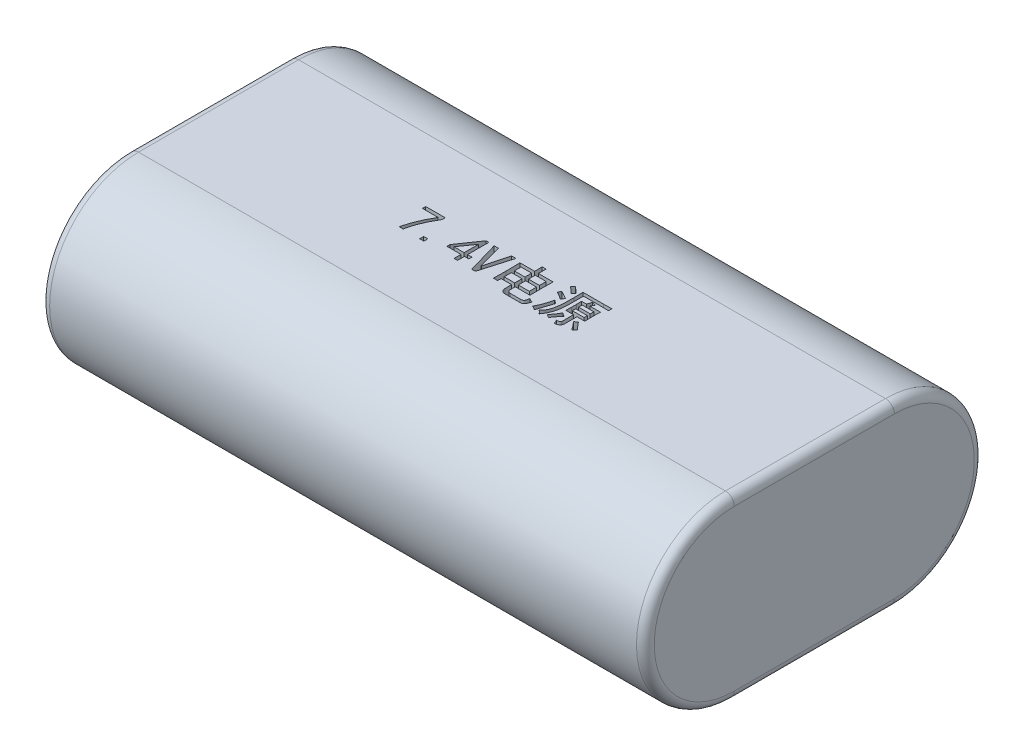
from build123d import *

# Parameters (mm, degrees)
EXTRUDE_1_DEPTH     = 68
FILLET_1_R          = 1
SKETCH_2_W          = 0.470760233
SKETCH_2_H          = 0.450292398
SKETCH_2_W_2        = 1.228070175
SKETCH_2_H_2        = 0.818713451
SKETCH_2_W_3        = 1.187134503
SKETCH_2_H_3        = 0.757309941
SKETCH_2_W_4        = 1.30994152
SKETCH_2_H_4        = 0.409356725
SKETCH_2_H_5        = 0.368421053
CUT_EXTRUDE_1_DEPTH = 2


with BuildPart() as part:
    # 草图1 → 凸台-拉伸1 (new body)
    with BuildSketch(Plane(origin=(0, 0, 0), x_dir=(0, 0, -1), z_dir=(1, 0, 0))):
        with BuildLine():
            Line((-13.318446602, 16.937864078), (4.681553398, 16.937864078))
            ThreePointArc((4.681553398, 16.937864078), (14.681553398, 6.937864078), (4.681553398, -3.062135922))
            Line((4.681553398, -3.062135922), (-13.318446602, -3.062135922))
            ThreePointArc((-13.318446602, -3.062135922), (-23.318446602, 6.937864078), (-13.318446602, 16.937864078))
        make_face()
    extrude(amount=EXTRUDE_1_DEPTH)

    # 圆角1
    fillet_1_edges = [part.edges().sort_by_distance(p)[0] for p in [
        (0, -3.062135922, 4.318446602),
        (0, 6.937864078, -14.681553398),
        (0, 16.937864078, 4.318446602),
        (0, 6.937864078, 23.318446602),
        (68, 16.937864078, 4.318446602),
        (68, 6.937864078, -14.681553398),
        (68, -3.062135922, 4.318446602),
        (68, 6.937864078, 23.318446602),
    ]]
    fillet(fillet_1_edges, radius=FILLET_1_R)

    # 草图2 → 切除-拉伸1 (cut)
    # profile 1 of 12: a face of its own
    with BuildSketch(Plane(origin=(0, 16.937864078, 0), x_dir=(1, 0, 0), z_dir=(0, 1, 0))):
        with BuildLine():
            add(Edge.make_bspline(
                [(22.913839218, -5.925550869), (22.946256994, -5.795595156), (23.011356885, -5.534624048), (23.131271824, -5.146912821), (23.265755822, -4.759243221), (23.418491729, -4.372399105), (23.588692665, -3.98613303), (23.775888162, -3.600437972), (23.980689836, -3.215435809), (24.128651632, -2.962525637), (24.203312902, -2.834907595)],
                knots=[0, 0, 0, 0, 0.95598223, 1.919759698, 2.895862736, 3.884710376, 4.887861096, 5.908430334, 6.944597505, 8, 8, 8, 8], degree=3))
            Line((24.203312902, -2.834907595), (22.443078984, -2.834907595))
            Line((22.443078984, -2.834907595), (22.443078984, -2.466486542))
            Line((22.443078984, -2.466486542), (24.633137464, -2.466486542))
            Line((24.633137464, -2.466486542), (24.633137464, -2.814439758))
            add(Edge.make_bspline(
                [(24.633137464, -2.814439758), (24.555151809, -2.943397307), (24.400982162, -3.198333165), (24.192504454, -3.588376978), (24.002202403, -3.977150388), (23.833055651, -4.36645168), (23.68374422, -4.755474601), (23.556872501, -5.145135171), (23.447536392, -5.53404855), (23.391818079, -5.795590511), (23.364131616, -5.925550869)],
                knots=[0, 0, 0, 0, 1.07060053, 2.116467542, 3.141042998, 4.145328357, 5.131291331, 6.100450916, 7.056112916, 8, 8, 8, 8], degree=3))
            Line((23.364131616, -5.925550869), (22.913839218, -5.925550869))
        make_face()
    # profile 2 of 12: a face of its own
    with BuildSketch(Plane(origin=(0, 16.937864078, 0), x_dir=(1, 0, 0), z_dir=(0, 1, 0))):
        with Locations((25.482552669, -5.720872507)):
            Rectangle(SKETCH_2_W, SKETCH_2_H)
    # profile 3 of 12: a face of its own
    with BuildSketch(Plane(origin=(0, 16.937864078, 0), x_dir=(1, 0, 0), z_dir=(0, 1, 0))):
        Polygon((29.095125768, -5.147773092), (27.519102376, -5.147773092), (27.519102376, -4.799819875), (29.176997113, -2.405083033), (29.484014657, -2.405083033), (29.484014657, -4.799819875), (29.975242727, -4.799819875), (29.975242727, -5.147773092), (29.484014657, -5.147773092), (29.484014657, -5.925550869), (29.095125768, -5.925550869), align=None)
        Polygon((29.095125768, -4.799819875), (29.095125768, -3.182860811), (27.948926938, -4.799819875), align=None, mode=Mode.SUBTRACT)
    # profile 4 of 12: a face of its own
    with BuildSketch(Plane(origin=(0, 16.937864078, 0), x_dir=(1, 0, 0), z_dir=(0, 1, 0))):
        Polygon((32.574657932, -2.446018706), (31.551266119, -5.986954378), (31.141909394, -5.986954378), (30.118517581, -2.446018706), (30.609745651, -2.446018706), (31.32611992, -5.127305255), (31.367055592, -5.127305255), (32.083429861, -2.446018706), align=None)
    # profile 5 of 12: a face of its own
    with BuildSketch(Plane(origin=(0, 16.937864078, 0), x_dir=(1, 0, 0), z_dir=(0, 1, 0))):
        with BuildLine():
            add(Edge.make_bspline(
                [(37.732552668, -5.782276016), (37.720819894, -5.819719132), (37.698311028, -5.891552277), (37.663850715, -5.993576187), (37.629357944, -6.084937268), (37.596921115, -6.166142176), (37.562865269, -6.235907602), (37.531824789, -6.296397653), (37.499971064, -6.345780227), (37.468360703, -6.386380842), (37.43335991, -6.418424108), (37.395117003, -6.446442835), (37.350896416, -6.468751904), (37.301754915, -6.487006335), (37.247883224, -6.50112547), (37.188886182, -6.51198327), (37.124693523, -6.517669113), (37.080118398, -6.518624873), (37.057114072, -6.519118121)],
                knots=[0, 0, 0, 0, 1.702174165, 3.265554056, 4.67040763, 5.938607077, 7.056486703, 8.037238336, 8.885550175, 9.602851616, 10.262105392, 10.937474938, 11.653267151, 12.40252239, 13.20818955, 14.06607918, 15.001942329, 16, 16, 16, 16], degree=3))
            Line((37.057114072, -6.519118121), (35.460622844, -6.519118121))
            add(Edge.make_bspline(
                [(35.460622844, -6.519118121), (35.438386642, -6.519361799), (35.39513964, -6.519835727), (35.331943764, -6.516487924), (35.272891189, -6.507212902), (35.21779417, -6.494045456), (35.167546305, -6.474555656), (35.120916821, -6.451865268), (35.077900843, -6.425013624), (35.040953524, -6.391252142), (35.005956316, -6.355201419), (34.97672961, -6.312807965), (34.950683359, -6.266533087), (34.929488723, -6.215346298), (34.913020572, -6.15961733), (34.900197227, -6.099297349), (34.890937741, -6.034462163), (34.888679982, -5.989512396), (34.887523429, -5.966486542)],
                knots=[0, 0, 0, 0, 1.168119821, 2.271866497, 3.319426777, 4.304575247, 5.241409998, 6.143755183, 7.027454658, 7.892819379, 8.76618987, 9.661182454, 10.588185367, 11.552088977, 12.564145767, 13.636803855, 14.789435116, 16, 16, 16, 16], degree=3))
            Line((34.887523429, -5.966486542), (34.887523429, -5.250112273))
            Line((34.887523429, -5.250112273), (33.700388926, -5.250112273))
            Line((33.700388926, -5.250112273), (33.700388926, -5.639001162))
            Line((33.700388926, -5.639001162), (33.229628692, -5.639001162))
            add(Edge.make_bspline(
                [(33.229628692, -5.639001162), (33.23041744, -5.62914848), (33.232196112, -5.60693014), (33.234399346, -5.569523108), (33.236582999, -5.524286974), (33.239067809, -5.471235413), (33.240263292, -5.410316948), (33.241845334, -5.341840682), (33.243369241, -5.265275235), (33.244796937, -5.181128502), (33.246576567, -5.088902753), (33.247023801, -4.98883085), (33.247862379, -4.88093355), (33.248613961, -4.765201569), (33.249311523, -4.641889052), (33.250325959, -4.510491965), (33.25003397, -4.371258583), (33.250075311, -4.275742131), (33.250096528, -4.22672046)],
                knots=[0, 0, 0, 0, 0.335849478, 0.75735909, 1.273172232, 1.874755125, 2.561862521, 3.343391738, 4.202179413, 5.163982611, 6.203049845, 7.336455448, 8.564306306, 9.869430823, 11.269001192, 12.754431635, 14.334285019, 16, 16, 16, 16], degree=3))
            add(Edge.make_bspline(
                [(33.250096528, -4.22672046), (33.250075824, -4.177446097), (33.250035371, -4.081171572), (33.2503234, -3.940169409), (33.249305657, -3.805740047), (33.248605105, -3.677626454), (33.247864566, -3.556082587), (33.247017025, -3.441109921), (33.246562655, -3.332952721), (33.24478671, -3.231124264), (33.243335934, -3.135859714), (33.241838013, -3.047164998), (33.240227521, -2.965043414), (33.239032327, -2.889473777), (33.23652737, -2.820501202), (33.234293672, -2.75808577), (33.232067428, -2.70223848), (33.230405809, -2.667121024), (33.229628692, -2.650697068)],
                knots=[0, 0, 0, 0, 1.500478727, 2.931704589, 4.293699324, 5.594136985, 6.833017677, 7.994952324, 9.095330294, 10.126543337, 11.096205569, 11.996624329, 12.827801185, 13.597431334, 14.298035147, 14.929427821, 15.499307993, 16, 16, 16, 16], degree=3))
            Line((33.229628692, -2.650697068), (34.887523429, -2.650697068))
            add(Edge.make_bspline(
                [(34.887523429, -2.650697068), (34.887673274, -2.60597015), (34.88796451, -2.519040231), (34.885915516, -2.392449016), (34.88471507, -2.273425137), (34.882511242, -2.161981165), (34.879144382, -2.058395885), (34.876718172, -1.962327301), (34.871767775, -1.874172597), (34.868573958, -1.817832474), (34.867055592, -1.791047945)],
                knots=[0, 0, 0, 0, 1.248126266, 2.425821371, 3.533006246, 4.56980153, 5.536277045, 6.425221315, 7.251338075, 8, 8, 8, 8], degree=3))
            Line((34.867055592, -1.791047945), (35.31734799, -1.791047945))
            add(Edge.make_bspline(
                [(35.31734799, -1.791047945), (35.315816437, -1.814799307), (35.312526094, -1.865826041), (35.307593199, -1.947664808), (35.305249426, -2.039949677), (35.301853575, -2.142270165), (35.299672554, -2.254726153), (35.298469321, -2.377540079), (35.296433797, -2.510701764), (35.29672788, -2.602937917), (35.296880154, -2.650697068)],
                knots=[0, 0, 0, 0, 0.664174484, 1.426893108, 2.28761838, 3.239966529, 4.283778659, 5.42618217, 6.667297463, 8, 8, 8, 8], degree=3))
            Line((35.296880154, -2.650697068), (36.954774891, -2.650697068))
            add(Edge.make_bspline(
                [(36.954774891, -2.650697068), (36.953223, -2.679754207), (36.949769222, -2.744421731), (36.944919003, -2.851797203), (36.942620616, -2.979699649), (36.939218805, -3.128267859), (36.937093074, -3.297072086), (36.935872404, -3.486340593), (36.933851943, -3.69606941), (36.934150724, -3.842884802), (36.934307054, -3.919702916)],
                knots=[0, 0, 0, 0, 0.550195381, 1.224476137, 2.032152029, 2.968797626, 4.034345488, 5.224058355, 6.547546001, 8, 8, 8, 8], degree=3))
            add(Edge.make_bspline(
                [(36.934307054, -3.919702916), (36.934152853, -3.995257586), (36.933856307, -4.140556858), (36.935895393, -4.350032762), (36.937098464, -4.542333696), (36.939259667, -4.717453841), (36.942654717, -4.875119849), (36.944999197, -5.015398), (36.94993238, -5.138436437), (36.953240933, -5.214736827), (36.954774891, -5.250112273)],
                knots=[0, 0, 0, 0, 1.362686635, 2.620584247, 3.77822015, 4.831086897, 5.779218089, 6.622549017, 7.361367053, 8, 8, 8, 8], degree=3))
            Line((36.954774891, -5.250112273), (35.296880154, -5.250112273))
            Line((35.296880154, -5.250112273), (35.296880154, -5.802743852))
            add(Edge.make_bspline(
                [(35.296880154, -5.802743852), (35.297899938, -5.831657073), (35.299828741, -5.886343046), (35.317912841, -5.962707356), (35.348460822, -6.027807967), (35.392423231, -6.080936279), (35.448495988, -6.123115053), (35.517605883, -6.151467816), (35.598079736, -6.16786235), (35.655362368, -6.170019728), (35.685769043, -6.171164905)],
                knots=[0, 0, 0, 0, 1.129091727, 2.135544834, 3.045847686, 3.916186791, 4.805388208, 5.761506281, 6.811766361, 8, 8, 8, 8], degree=3))
            Line((35.685769043, -6.171164905), (36.770564364, -6.171164905))
            add(Edge.make_bspline(
                [(36.770564364, -6.171164905), (36.79660653, -6.170783332), (36.845759274, -6.17006314), (36.91550045, -6.163309972), (36.976591165, -6.15210548), (37.030188584, -6.137492489), (37.074912279, -6.116837201), (37.112752896, -6.093036877), (37.140655497, -6.06247215), (37.168272719, -6.014188869), (37.191562453, -5.940141839), (37.218162791, -5.837666252), (37.241962307, -5.714525245), (37.254867536, -5.625414277), (37.261792435, -5.577597653)],
                knots=[0, 0, 0, 0, 1.042518898, 1.967680623, 2.801111341, 3.527935752, 4.184388731, 4.768041076, 5.305018465, 5.822088252, 6.9838114, 8.39479634, 10.06546074, 12, 12, 12, 12], degree=3))
            add(Edge.make_bspline(
                [(37.261792435, -5.577597653), (37.296702286, -5.600638253), (37.366923119, -5.6469842), (37.482087493, -5.702509871), (37.603923632, -5.749451421), (37.689332534, -5.771246753), (37.732552668, -5.782276016)],
                knots=[0, 0, 0, 0, 0.971041445, 1.953240594, 2.964262336, 4, 4, 4, 4], degree=3))
        make_face()
        with Locations((35.910915241, -4.492802332)):
            Rectangle(SKETCH_2_W_2, SKETCH_2_H_2, mode=Mode.SUBTRACT)
        with Locations((34.293956178, -4.492802332)):
            Rectangle(SKETCH_2_W_3, SKETCH_2_H_2, mode=Mode.SUBTRACT)
        with Locations((35.910915241, -3.377305256)):
            Rectangle(SKETCH_2_W_2, SKETCH_2_H_3, mode=Mode.SUBTRACT)
        with Locations((34.293956178, -3.377305256)):
            Rectangle(SKETCH_2_W_3, SKETCH_2_H_3, mode=Mode.SUBTRACT)
    # profile 6 of 12: a face of its own
    with BuildSketch(Plane(origin=(0, 16.937864078, 0), x_dir=(1, 0, 0), z_dir=(0, 1, 0))):
        with BuildLine():
            add(Edge.make_bspline(
                [(41.600973721, -2.527890051), (41.583828583, -2.55682582), (41.548012124, -2.617273088), (41.496372681, -2.7143863), (41.446055164, -2.822342107), (41.413291909, -2.897998572), (41.396295359, -2.937246776)],
                knots=[0, 0, 0, 0, 0.880967354, 1.840354399, 2.879643524, 4, 4, 4, 4], degree=3))
            Line((41.396295359, -2.937246776), (42.562962025, -2.937246776))
            add(Edge.make_bspline(
                [(42.562962025, -2.937246776), (42.557087032, -3.039558591), (42.545343321, -3.244072959), (42.543443561, -3.448915374), (42.542494189, -3.551281864)],
                knots=[0, 0, 0, 0, 1.000534248, 2, 2, 2, 2], degree=3))
            Line((42.542494189, -3.551281864), (42.542494189, -4.06297777))
            add(Edge.make_bspline(
                [(42.542494189, -4.06297777), (42.542879842, -4.104420949), (42.54372181, -4.19490101), (42.547874508, -4.341968789), (42.553730394, -4.512054483), (42.559754392, -4.633052293), (42.562962025, -4.697480694)],
                knots=[0, 0, 0, 0, 0.783340305, 1.710213359, 2.780744113, 4, 4, 4, 4], degree=3))
            Line((42.562962025, -4.697480694), (41.682845066, -4.697480694))
            Line((41.682845066, -4.697480694), (41.682845066, -6.068825723))
            add(Edge.make_bspline(
                [(41.682845066, -6.068825723), (41.682506243, -6.088816161), (41.681847388, -6.127688411), (41.673937927, -6.184007383), (41.661856546, -6.236811023), (41.645274252, -6.286162767), (41.623923166, -6.332351771), (41.597263279, -6.374728587), (41.566049426, -6.413998953), (41.529092933, -6.448785079), (41.487850263, -6.480960734), (41.441150855, -6.510046598), (41.388677137, -6.535111673), (41.331641423, -6.559395738), (41.268362933, -6.578338167), (41.199852283, -6.595857801), (41.126078118, -6.611267803), (41.074676529, -6.618005435), (41.048342142, -6.621457302)],
                knots=[0, 0, 0, 0, 1.019536655, 1.982532068, 2.895982291, 3.780949504, 4.634831996, 5.486471658, 6.330362293, 7.187743521, 8.069981526, 8.996807078, 9.988811529, 11.035394584, 12.157070259, 13.355032337, 14.644913431, 16, 16, 16, 16], degree=3))
            add(Edge.make_bspline(
                [(41.048342142, -6.621457302), (41.037157104, -6.583663077), (41.014647152, -6.507601988), (40.972350469, -6.394693543), (40.922711068, -6.281922909), (40.883792419, -6.2083382), (40.864131616, -6.171164905)],
                knots=[0, 0, 0, 0, 0.969823912, 1.951776047, 2.965284552, 4, 4, 4, 4], degree=3))
            add(Edge.make_bspline(
                [(40.864131616, -6.171164905), (40.897688276, -6.175141864), (40.960122473, -6.182541238), (41.048121471, -6.182838837), (41.123052516, -6.174280491), (41.18532538, -6.154090885), (41.234282453, -6.122339282), (41.270328092, -6.079959289), (41.290566307, -6.025962838), (41.292779887, -5.987124907), (41.293956177, -5.966486542)],
                knots=[0, 0, 0, 0, 1.466553914, 2.728612351, 3.813527, 4.729743298, 5.545475797, 6.316892523, 7.105601505, 8, 8, 8, 8], degree=3))
            Line((41.293956177, -5.966486542), (41.293956177, -4.697480694))
            Line((41.293956177, -4.697480694), (40.434307054, -4.697480694))
            add(Edge.make_bspline(
                [(40.434307054, -4.697480694), (40.437555877, -4.643668576), (40.443944142, -4.537856042), (40.44966004, -4.381648899), (40.453714484, -4.230784382), (40.454425697, -4.131964511), (40.454774891, -4.083445606)],
                knots=[0, 0, 0, 0, 1.052783815, 2.070123375, 3.052462826, 4, 4, 4, 4], degree=3))
            Line((40.454774891, -4.083445606), (40.454774891, -3.530814027))
            add(Edge.make_bspline(
                [(40.454774891, -3.530814027), (40.454422979, -3.485074609), (40.453701551, -3.391307746), (40.449605279, -3.246761767), (40.443880564, -3.094599274), (40.437550308, -2.990553668), (40.434307054, -2.937246776)],
                knots=[0, 0, 0, 0, 0.924024399, 1.894271337, 2.921147625, 4, 4, 4, 4], degree=3))
            Line((40.434307054, -2.937246776), (40.986938633, -2.937246776))
            add(Edge.make_bspline(
                [(40.986938633, -2.937246776), (41.000970385, -2.903787179), (41.031231615, -2.831627365), (41.071272666, -2.712112644), (41.112168555, -2.575063308), (41.137378454, -2.477194638), (41.150681323, -2.425550869)],
                knots=[0, 0, 0, 0, 0.809292357, 1.745340374, 2.810251326, 4, 4, 4, 4], degree=3))
            add(Edge.make_bspline(
                [(41.150681323, -2.425550869), (41.185467428, -2.435726911), (41.256672535, -2.456556667), (41.366950256, -2.482179719), (41.482095273, -2.507015384), (41.560744423, -2.520825918), (41.600973721, -2.527890051)],
                knots=[0, 0, 0, 0, 0.941104212, 1.926384854, 2.939339067, 4, 4, 4, 4], degree=3))
        make_face()
        with Locations((41.49863454, -3.469410519)):
            Rectangle(SKETCH_2_W_4, SKETCH_2_H_4, mode=Mode.SUBTRACT)
        with Locations((41.49863454, -4.185784788)):
            Rectangle(SKETCH_2_W_4, SKETCH_2_H_5, mode=Mode.SUBTRACT)
    # profile 7 of 12: a face of its own
    with BuildSketch(Plane(origin=(0, 16.937864078, 0), x_dir=(1, 0, 0), z_dir=(0, 1, 0))):
        with BuildLine():
            add(Edge.make_bspline(
                [(38.919687171, -6.191632741), (38.965300878, -6.146979412), (39.054825606, -6.059339592), (39.171718777, -5.915940549), (39.271577146, -5.766802137), (39.352504689, -5.608454848), (39.420271617, -5.440480397), (39.477465784, -5.259806578), (39.526699909, -5.065691198), (39.566099495, -4.858991947), (39.596925666, -4.64358862), (39.622841015, -4.423014629), (39.637929725, -4.198342949), (39.646933099, -3.969047851), (39.650344231, -3.733219293), (39.654913968, -3.489389196), (39.655815274, -3.236683635), (39.656288485, -3.065359875), (39.656529277, -2.978182448)],
                knots=[0, 0, 0, 0, 0.901603263, 1.769551138, 2.609537639, 3.433773642, 4.278046628, 5.166940785, 6.11024825, 7.10696977, 8.139365354, 9.185324274, 10.245136354, 11.321002583, 12.428365426, 13.57851718, 14.767837911, 16, 16, 16, 16], degree=3))
            add(Edge.make_bspline(
                [(39.656529277, -2.978182448), (39.656206971, -2.888223275), (39.655577722, -2.712592766), (39.6515894, -2.455347897), (39.646105, -2.210953687), (39.639345235, -2.052320268), (39.63606144, -1.975258472)],
                knots=[0, 0, 0, 0, 1.076051581, 2.100813952, 3.077403175, 4, 4, 4, 4], degree=3))
            Line((39.63606144, -1.975258472), (41.969394774, -1.975258472))
            add(Edge.make_bspline(
                [(41.969394774, -1.975258472), (42.046972236, -1.97492511), (42.200619868, -1.974264864), (42.428301227, -1.970286246), (42.650960917, -1.964665747), (42.797466317, -1.958060113), (42.869979569, -1.954790636)],
                knots=[0, 0, 0, 0, 1.033337088, 2.046596933, 3.033157762, 4, 4, 4, 4], degree=3))
            Line((42.869979569, -1.954790636), (42.869979569, -2.343679524))
            add(Edge.make_bspline(
                [(42.869979569, -2.343679524), (42.797466317, -2.340410047), (42.650960917, -2.333804413), (42.428301227, -2.328183914), (42.200619868, -2.324205296), (42.046972236, -2.32354505), (41.969394774, -2.323211688)],
                knots=[0, 0, 0, 0, 0.966842238, 1.953403067, 2.966662912, 4, 4, 4, 4], degree=3))
            Line((41.969394774, -2.323211688), (40.045418166, -2.323211688))
            Line((40.045418166, -2.323211688), (40.045418166, -3.694556717))
            add(Edge.make_bspline(
                [(40.045418166, -3.694556717), (40.044848337, -3.774407927), (40.043733804, -3.930589691), (40.03894199, -4.159090056), (40.028724927, -4.376170184), (40.015809768, -4.583063351), (39.995651203, -4.783031868), (39.965346176, -4.978942165), (39.924412971, -5.172560486), (39.873073367, -5.361559632), (39.814823312, -5.542526435), (39.753907045, -5.713126341), (39.687989682, -5.870700256), (39.617703025, -6.017650402), (39.540024522, -6.156453764), (39.457777943, -6.293351407), (39.366718486, -6.428310527), (39.300875731, -6.515861053), (39.267640388, -6.560053793)],
                knots=[0, 0, 0, 0, 1.263902685, 2.472079671, 3.617121112, 4.703377033, 5.752820275, 6.797022267, 7.839514794, 8.883441008, 9.895325399, 10.847990306, 11.749727231, 12.597633167, 13.424681536, 14.26630085, 15.124883419, 16, 16, 16, 16], degree=3))
            add(Edge.make_bspline(
                [(39.267640388, -6.560053793), (39.248710997, -6.526007643), (39.209851225, -6.45611497), (39.12942889, -6.361390324), (39.032749182, -6.271224829), (38.958287849, -6.2188064), (38.919687171, -6.191632741)],
                knots=[0, 0, 0, 0, 0.910578391, 1.869308447, 2.895451717, 4, 4, 4, 4], degree=3))
        make_face()
    # profile 8 of 12: a face of its own
    with BuildSketch(Plane(origin=(0, 16.937864078, 0), x_dir=(1, 0, 0), z_dir=(0, 1, 0))):
        with BuildLine():
            add(Edge.make_bspline(
                [(39.206236879, -4.595141513), (39.181276377, -4.666585639), (39.128985033, -4.816258484), (39.051157129, -5.052028233), (38.965283314, -5.307517466), (38.8937535, -5.531638525), (38.834911436, -5.712918231), (38.794208835, -5.841945245), (38.756104347, -5.961150506), (38.721359081, -6.070857831), (38.689622126, -6.170954834), (38.660399897, -6.261207568), (38.635716347, -6.342251885), (38.620013402, -6.393031095), (38.612669628, -6.41677894)],
                knots=[0, 0, 0, 0, 1.421921613, 2.978874024, 4.664946771, 6.486219723, 7.399115305, 8.245990026, 9.028289969, 9.750539788, 10.408214639, 11.001315107, 11.532946371, 12, 12, 12, 12], degree=3))
            add(Edge.make_bspline(
                [(38.612669628, -6.41677894), (38.580197206, -6.392717815), (38.512814013, -6.342788818), (38.400410209, -6.276391407), (38.276514091, -6.21040796), (38.187919632, -6.171107295), (38.141909394, -6.150697068)],
                knots=[0, 0, 0, 0, 0.894084629, 1.855305958, 2.886184464, 4, 4, 4, 4], degree=3))
            add(Edge.make_bspline(
                [(38.141909394, -6.150697068), (38.152685851, -6.135391762), (38.176264556, -6.101904013), (38.210805992, -6.044879377), (38.247643964, -5.977439815), (38.287240443, -5.899532349), (38.329292162, -5.811249173), (38.374382402, -5.712329595), (38.420663168, -5.6024829), (38.48926543, -5.4403535), (38.571690983, -5.220967673), (38.662586086, -4.940994056), (38.745064757, -4.641839224), (38.792836904, -4.435122513), (38.81734799, -4.329059641)],
                knots=[0, 0, 0, 0, 0.345155323, 0.755193972, 1.228681111, 1.762254886, 2.366765313, 3.03209822, 3.767044204, 4.565054036, 6.278902494, 8.087252555, 9.992435017, 12, 12, 12, 12], degree=3))
            add(Edge.make_bspline(
                [(38.81734799, -4.329059641), (38.850760249, -4.355342636), (38.915920401, -4.40659939), (39.014363879, -4.47720881), (39.110813091, -4.539436325), (39.175021163, -4.576918831), (39.206236879, -4.595141513)],
                knots=[0, 0, 0, 0, 1.081341952, 2.108819011, 3.080574027, 4, 4, 4, 4], degree=3))
        make_face()
    # profile 9 of 12: a face of its own
    with BuildSketch(Plane(origin=(0, 16.937864078, 0), x_dir=(1, 0, 0), z_dir=(0, 1, 0))):
        with BuildLine():
            add(Edge.make_bspline(
                [(39.79980413, -6.130229232), (39.827855671, -6.101154825), (39.886131893, -6.040753629), (39.971959126, -5.941635634), (40.059478338, -5.830565558), (40.15067604, -5.708711415), (40.242760099, -5.575125246), (40.334513025, -5.429408851), (40.427189771, -5.273024363), (40.486016187, -5.163165581), (40.516178399, -5.106837419)],
                knots=[0, 0, 0, 0, 0.773418412, 1.606753217, 2.508911836, 3.4803915, 4.520431753, 5.614317553, 6.776783206, 8, 8, 8, 8], degree=3))
            add(Edge.make_bspline(
                [(40.516178399, -5.106837419), (40.542198781, -5.13096261), (40.596685127, -5.181480452), (40.69304652, -5.248052524), (40.803126021, -5.313630243), (40.883509901, -5.352564305), (40.925535125, -5.372919291)],
                knots=[0, 0, 0, 0, 0.867170776, 1.815844496, 2.858109072, 4, 4, 4, 4], degree=3))
            add(Edge.make_bspline(
                [(40.925535125, -5.372919291), (40.891571505, -5.404419075), (40.822931538, -5.468079671), (40.729974913, -5.575818145), (40.638633869, -5.689421961), (40.555597226, -5.815573734), (40.468812264, -5.947991037), (40.371126981, -6.085275772), (40.263740398, -6.229123011), (40.187162921, -6.32599464), (40.147757347, -6.375843267)],
                knots=[0, 0, 0, 0, 0.873440914, 1.765211047, 2.681949787, 3.622293932, 4.612848446, 5.669927635, 6.800981153, 8, 8, 8, 8], degree=3))
            add(Edge.make_bspline(
                [(40.147757347, -6.375843267), (40.117490827, -6.352775613), (40.058323021, -6.307680821), (39.970730856, -6.242865906), (39.884671706, -6.184469801), (39.82768047, -6.14804556), (39.79980413, -6.130229232)],
                knots=[0, 0, 0, 0, 1.071757648, 2.095171425, 3.068283966, 4, 4, 4, 4], degree=3))
        make_face()
    # profile 10 of 12: a face of its own
    with BuildSketch(Plane(origin=(0, 16.937864078, 0), x_dir=(1, 0, 0), z_dir=(0, 1, 0))):
        with BuildLine():
            add(Edge.make_bspline(
                [(42.276412318, -5.127305255), (42.321932852, -5.177810064), (42.408912832, -5.274313925), (42.532372933, -5.412440344), (42.641541168, -5.53796669), (42.738049473, -5.649452301), (42.821481016, -5.747312915), (42.89037823, -5.832711304), (42.946981669, -5.903415565), (42.97876718, -5.947182552), (42.992786587, -5.966486542)],
                knots=[0, 0, 0, 0, 1.478378342, 2.824864029, 4.028126643, 5.095473925, 6.031127987, 6.824010453, 7.481314751, 8, 8, 8, 8], degree=3))
            add(Edge.make_bspline(
                [(42.992786587, -5.966486542), (42.934157393, -6.013374232), (42.820760934, -6.104061102), (42.715931057, -6.204518286), (42.665301207, -6.25303625)],
                knots=[0, 0, 0, 0, 1.034056852, 2, 2, 2, 2], degree=3))
            add(Edge.make_bspline(
                [(42.665301207, -6.25303625), (42.612502109, -6.180505758), (42.510565776, -6.040475103), (42.383313991, -5.866037454), (42.277543619, -5.727664159), (42.186866609, -5.616868107), (42.083025751, -5.497226205), (42.008503196, -5.415702054), (41.969394774, -5.372919291)],
                knots=[0, 0, 0, 0, 1.438054388, 2.776373007, 3.460947953, 4.229563947, 5.07089927, 6, 6, 6, 6], degree=3))
            add(Edge.make_bspline(
                [(41.969394774, -5.372919291), (41.993754913, -5.355113336), (42.043989002, -5.318394913), (42.119335981, -5.25920464), (42.197748682, -5.195633784), (42.249759073, -5.150456702), (42.276412318, -5.127305255)],
                knots=[0, 0, 0, 0, 0.92053851, 1.898281969, 2.922953589, 4, 4, 4, 4], degree=3))
        make_face()
    # profile 11 of 12: a face of its own
    with BuildSketch(Plane(origin=(0, 16.937864078, 0), x_dir=(1, 0, 0), z_dir=(0, 1, 0))):
        with BuildLine():
            add(Edge.make_bspline(
                [(39.022026353, -3.940170753), (38.993885353, -3.913172964), (38.937053451, -3.858649824), (38.842992288, -3.784432303), (38.741582325, -3.715361634), (38.669568973, -3.674362487), (38.633137464, -3.653621045)],
                knots=[0, 0, 0, 0, 0.965069128, 1.948996614, 2.962398672, 4, 4, 4, 4], degree=3))
            Line((38.633137464, -3.653621045), (38.182845066, -3.40800701))
            add(Edge.make_bspline(
                [(38.182845066, -3.40800701), (38.197037547, -3.383267214), (38.226374266, -3.332128556), (38.270868458, -3.252651797), (38.317998887, -3.168185354), (38.35037175, -3.110335449), (38.367055592, -3.08052163)],
                knots=[0, 0, 0, 0, 0.910883584, 1.882851653, 2.908895726, 4, 4, 4, 4], degree=3))
            add(Edge.make_bspline(
                [(38.367055592, -3.08052163), (38.399085516, -3.098323557), (38.466195648, -3.135622733), (38.572225888, -3.191512146), (38.68584827, -3.253998456), (38.807450138, -3.316385875), (38.930017897, -3.380841114), (39.048376112, -3.445574179), (39.160778648, -3.507974872), (39.232620196, -3.550849735), (39.267640388, -3.5717497)],
                knots=[0, 0, 0, 0, 0.857183934, 1.795999539, 2.803673391, 3.89031045, 4.992907666, 6.043030471, 7.046047187, 8, 8, 8, 8], degree=3))
            Line((39.267640388, -3.5717497), (39.022026353, -3.940170753))
        make_face()
    # profile 12 of 12: a face of its own
    with BuildSketch(Plane(origin=(0, 16.937864078, 0), x_dir=(1, 0, 0), z_dir=(0, 1, 0))):
        with BuildLine():
            add(Edge.make_bspline(
                [(39.103897698, -2.793971922), (39.043725505, -2.728323341), (38.927145408, -2.601133061), (38.74563528, -2.427670071), (38.568750014, -2.272391745), (38.446525138, -2.182428965), (38.387523429, -2.139001162)],
                knots=[0, 0, 0, 0, 1.09847737, 2.12823556, 3.096441688, 4, 4, 4, 4], degree=3))
            add(Edge.make_bspline(
                [(38.387523429, -2.139001162), (38.429801671, -2.09084732), (38.515832975, -1.992859857), (38.607159328, -1.899786104), (38.6536053, -1.852451454)],
                knots=[0, 0, 0, 0, 0.982857193, 2, 2, 2, 2], degree=3))
            add(Edge.make_bspline(
                [(38.6536053, -1.852451454), (38.697942315, -1.886922867), (38.783000013, -1.953054043), (38.903351785, -2.050393347), (39.01308498, -2.139970132), (39.111192562, -2.222524742), (39.196988841, -2.299064338), (39.272602835, -2.36692957), (39.336168822, -2.428563497), (39.373407158, -2.468623114), (39.390447405, -2.486954378)],
                knots=[0, 0, 0, 0, 1.384778858, 2.656608722, 3.816607695, 4.877673514, 5.817862813, 6.651509391, 7.382931249, 8, 8, 8, 8], degree=3))
            add(Edge.make_bspline(
                [(39.390447405, -2.486954378), (39.342293392, -2.536111938), (39.244304809, -2.636142635), (39.15123215, -2.740764056), (39.103897698, -2.793971922)],
                knots=[0, 0, 0, 0, 0.982849476, 2, 2, 2, 2], degree=3))
        make_face()
    extrude(amount=-CUT_EXTRUDE_1_DEPTH, mode=Mode.SUBTRACT)


solid = part.part
